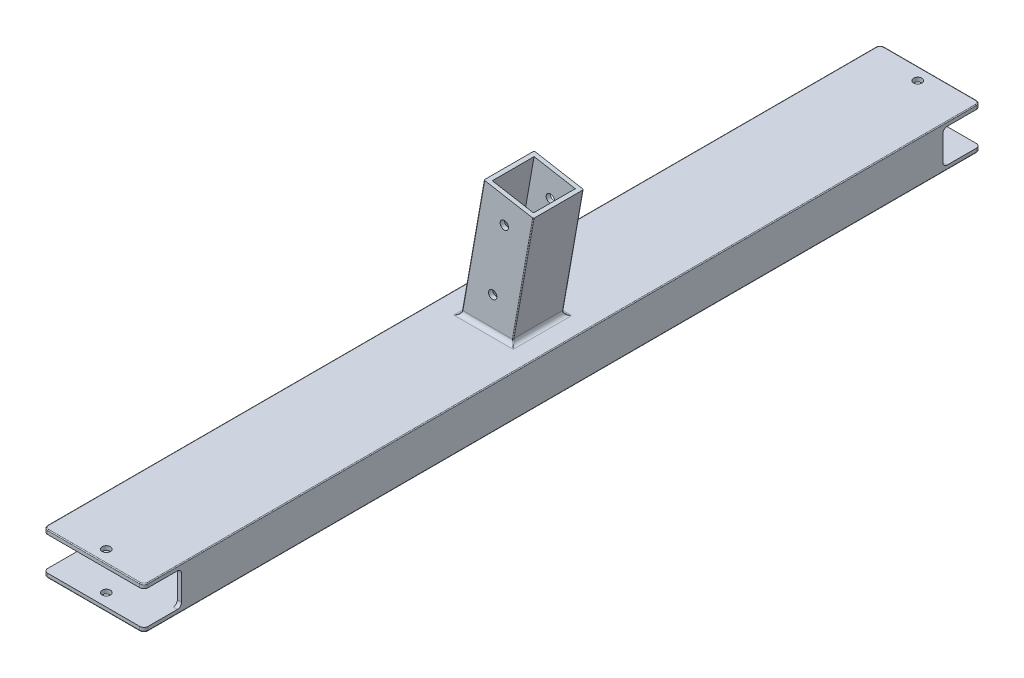
from build123d import *

# Parameters (mm, degrees)
SKETCH_1_W          = 120
SKETCH_1_H          = 50
SKETCH_1_W_2        = 110
SKETCH_1_H_2        = 40
EXTRUDE_1_DEPTH     = 1000
SKETCH_2_W          = 45
SKETCH_2_H          = 40
CUT_EXTRUDE_1_DEPTH = 1008.484491196
SKETCH_3_R          = 5
CUT_EXTRUDE_2_DEPTH = 1004.045362882
EXTRUDE_START       = 470
EXTRUDE_2_DEPTH     = 60
EXTRUDE_2_2_DEPTH   = 5
EXTRUDE_START_2     = 525
EXTRUDE_2_3_DEPTH   = 5
SKETCH_6_R          = 5
CUT_EXTRUDE_3_DEPTH = 563.280447254
FILLET_1_R          = 5
FILLET_2_R          = 1


# Read off the part's stored shape, not the designer's step: 拉伸-薄壁2
with BuildPart() as part:
    # 草图1 → 拉伸-薄壁1 (new body)
    with BuildSketch(Plane.XY):
        Rectangle(SKETCH_1_W, SKETCH_1_H)
        Rectangle(SKETCH_1_W_2, SKETCH_1_H_2, mode=Mode.SUBTRACT)
    extrude(amount=EXTRUDE_1_DEPTH)

    # 草图2 → 切除-拉伸1 (cut, through all)
    with BuildSketch(Plane(origin=(60, 0, 0), x_dir=(0, 0, -1), z_dir=(1, 0, 0))):
        with Locations((-977.5, 0)):
            Rectangle(SKETCH_2_W, SKETCH_2_H)
        with Locations((-22.5, 0)):
            Rectangle(SKETCH_2_W, SKETCH_2_H)
    extrude(amount=-CUT_EXTRUDE_1_DEPTH, mode=Mode.SUBTRACT)

    # 草图3 → 切除-拉伸2 (cut, through all)
    with BuildSketch(Plane(origin=(0, 25, 0), x_dir=(1, 0, 0), z_dir=(0, 1, 0))):
        with Locations(Location((0, -985, 0), (0, 0, 270))):
            Circle(SKETCH_3_R)
        with Locations(Location((0, -15, 0), (0, 0, 180))):
            Circle(SKETCH_3_R)
    extrude(amount=-CUT_EXTRUDE_2_DEPTH, mode=Mode.SUBTRACT)

    # 拉伸-薄壁2 outline → 拉伸-薄壁2 (add)
    with BuildSketch(Plane.XY.offset(EXTRUDE_START)):
        Polygon((22.528084225, -20), (29.581163453, 20), (24.504030394, 20), (17.450951165, -20), align=None)
        Polygon((-33.320379429, -20), (-26.267300201, 20), (-31.34443326, 20), (-38.397512488, -20), align=None)
        Polygon((30.462798357, 25), (55.59145924, 167.511717622), (50.667420475, 168.37995851), (25.385665297, 25), align=None)
        Polygon((-25.385665297, 25), (1.427032825, 177.062367394), (-3.49700594, 177.930608282), (-30.462798357, 25), align=None)
    extrude(amount=EXTRUDE_2_DEPTH)

    # Extrude 2 2 outline → Extrude 2 2 (add)
    with BuildSketch(Plane.XY.offset(EXTRUDE_START)):
        Polygon((17.450951165, -20), (24.504030394, 20), (-26.267300201, 20), (-33.320379429, -20), align=None)
        Polygon((25.385665297, 25), (50.667420475, 168.37995851), (1.427032825, 177.062367394), (-25.385665297, 25), align=None)
    extrude(amount=EXTRUDE_2_2_DEPTH)

    # Extrude 2 3 outline → Extrude 2 3 (add)
    with BuildSketch(Plane.XY.offset(EXTRUDE_START_2)):
        Polygon((17.450951165, -20), (24.504030394, 20), (-26.267300201, 20), (-33.320379429, -20), align=None)
        Polygon((25.385665297, 25), (50.667420475, 168.37995851), (1.427032825, 177.062367394), (-25.385665297, 25), align=None)
    extrude(amount=EXTRUDE_2_3_DEPTH)

    # 草图6 → 切除-拉伸3 (cut, through all)
    with BuildSketch(Plane.XY.offset(530)):
        with Locations((20.83778132, 143.176930361)):
            Circle(SKETCH_6_R)
        with Locations((6.945927107, 64.39231012)):
            Circle(SKETCH_6_R)
    extrude(amount=-CUT_EXTRUDE_3_DEPTH, mode=Mode.SUBTRACT)

    # 圆角1
    fillet_1_edges = [part.edges().sort_by_distance(p)[0] for p in [
        (0, 25, 470),
        (0, 25, 530),
        (30.462798357, 25, 500),
        (-30.462798357, 25, 500),
        (-60, 22.5, 1000),
        (-60, -22.5, 0),
        (-60, -22.5, 1000),
        (60, 22.5, 0),
        (60, 22.5, 1000),
        (-60, 22.5, 0),
        (57.5, -20, 955),
        (57.5, 20, 955),
        (60, -22.5, 0),
        (-57.5, 20, 955),
        (-57.5, -20, 955),
        (60, -22.5, 1000),
        (57.5, 20, 45),
        (57.5, -20, 45),
        (-57.5, -20, 45),
        (-57.5, 20, 45),
    ]]
    fillet(fillet_1_edges, radius=FILLET_1_R)

    # 圆角2
    fillet_2_edges = [part.edges().sort_by_distance(p)[0] for p in [
        (43.544493397, 99.189979255, 470),
        (-16.539084697, 103.965304141, 530),
        (43.544493397, 99.189979255, 530),
        (-16.539084697, 103.965304141, 470),
        (-60, 25, 500),
        (-60, -25, 500),
        (0, 25, 0),
        (0, 25, 1000),
        (60, 25, 500),
        (58.535533906, 25, 998.535533906),
        (-58.535533906, 25, 998.535533906),
        (58.535533906, 25, 1.464466094),
        (-58.535533906, 25, 1.464466094),
        (0, -25, 0),
        (60, -25, 500),
        (0, -25, 1000),
        (58.535533906, -25, 998.535533906),
        (-58.535533906, -25, 998.535533906),
        (58.535533906, -25, 1.464466094),
        (-58.535533906, -25, 1.464466094),
        (-29.657994263, 29.564270829, 469.980977825),
        (31.440592829, 30.435778714, 470),
        (31.440592829, 30.435778714, 530),
        (-29.657994263, 29.564270829, 530.019022175),
        (55, 20, 500),
        (33.191321783, 26.183519916, 531.769755463),
        (-31.698814262, 25.969929925, 532.04051775),
        (33.191321783, 26.183519916, 468.230244537),
        (-31.698814262, 25.969929925, 467.95948225),
    ]]
    fillet(fillet_2_edges, radius=FILLET_2_R)


solid = part.part
